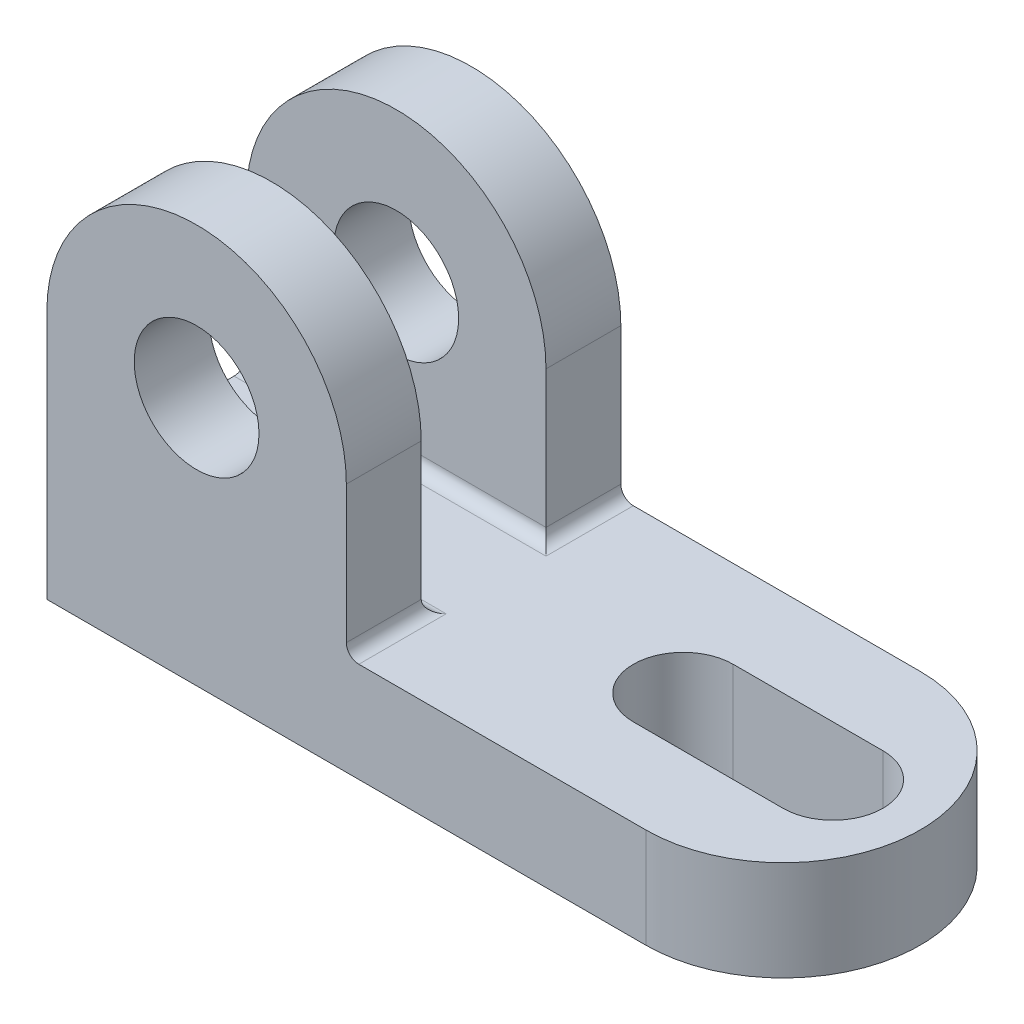
from build123d import *

# Parameters (mm, degrees)
BOSS_EXTRUDE1_DEPTH = 16
CUT_EXTRUDE1_DEPTH  = 65.969223483
SKETCH3_R           = 10
BOSS_EXTRUDE2_DEPTH = 12
FILLET1_R           = 2
FILLET3_R           = 2


with BuildPart() as part:
    # Sketch1 → Boss-Extrude1 (new body)
    with BuildSketch(Plane(origin=(0, 0, 0), x_dir=(1, 0, 0), z_dir=(0, 1, 0))):
        with BuildLine():
            Line((-59, -22), (37, -22))
            ThreePointArc((37, -22), (59, 0), (37, 22))
            Line((37, 22), (-59, 22))
            Line((-59, 22), (-59, -22))
        make_face()
    extrude(amount=BOSS_EXTRUDE1_DEPTH)

    # Sketch2 → Cut-Extrude1 (cut, through all)
    with BuildSketch(Plane(origin=(0, 16, 0), x_dir=(1, 0, 0), z_dir=(0, 1, 0))):
        with BuildLine():
            Line((21, -8), (45, -8))
            ThreePointArc((45, -8), (53, 0), (45, 8))
            Line((45, 8), (21, 8))
            ThreePointArc((21, 8), (13, 0), (21, -8))
        make_face()
    extrude(amount=-CUT_EXTRUDE1_DEPTH, mode=Mode.SUBTRACT)

    # Sketch3 → Boss-Extrude2 (add)
    with BuildSketch(Plane.XY.offset(22)):
        with BuildLine():
            Line((-59, 40), (-59, 16))
            Line((-59, 16), (-11, 16))
            Line((-11, 16), (-11, 40))
            ThreePointArc((-11, 40), (-35, 64), (-59, 40))
        make_face()
        with Locations((-35, 40)):
            Circle(SKETCH3_R, mode=Mode.SUBTRACT)
    boss_extrude2 = extrude(amount=-BOSS_EXTRUDE2_DEPTH)

    # Fillet1
    fillet1_edges = [part.edges().sort_by_distance(p)[0] for p in [
        (-35, 16, 10),
        (-11, 16, 16),
    ]]
    fillet(fillet1_edges, radius=FILLET1_R)

    # Mirror1: Boss-Extrude2 across plane
    add(boss_extrude2.mirror(Plane.XY))

    # Fillet3
    fillet3_edges = [part.edges().sort_by_distance(p)[0] for p in [
        (-11, 16, -16),
        (-35, 16, -10),
    ]]
    fillet(fillet3_edges, radius=FILLET3_R)


solid = part.part
